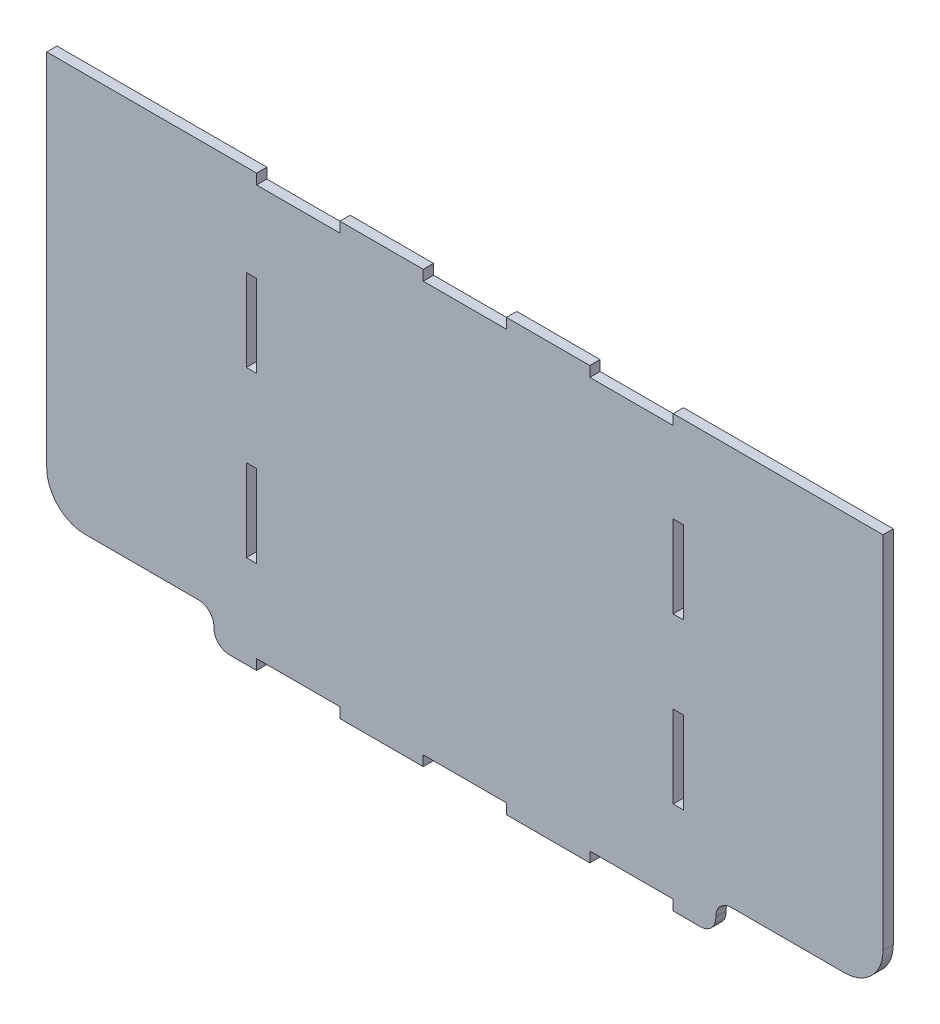
from build123d import *

# Parameters (mm, degrees)
BOSS_EXTRUDE1_DEPTH = 10.16
SKETCH2_W           = 10.166490401
SKETCH2_H           = 81.316938585
SKETCH2_W_2         = 10.166490402
SKETCH2_H_2         = 81.316938584
SKETCH2_W_3         = 82.271298803
SKETCH2_H_3         = 10.16
CUT_EXTRUDE2_DEPTH  = 137.414
CUT_EXTRUDE3_DEPTH  = 1426.179737238
SKETCH5_W           = 82.296
SKETCH5_H           = 10.16
CUT_EXTRUDE4_DEPTH  = 1408.779997291
CUT_EXTRUDE5_DEPTH  = 1408.779997291
CUT_EXTRUDE6_DEPTH  = 25.4


with BuildPart() as part:
    # Sketch1 → Boss-Extrude1 (new body)
    with BuildSketch(Plane.XY):
        with BuildLine():
            Line((0, 0), (1345.447057269, 0))
            Line((1345.447057269, 0), (1156.937235756, -454.288839135))
            add(Edge.make_bspline(
                [(1156.937235756, -454.288839135), (1155.965204773, -456.631331547), (1154.630956054, -458.816896883), (1152.225947859, -461.69350105), (1151.355065983, -462.590813772), (1149.473312624, -464.260936999), (1148.45987476, -465.033112958), (1146.360299176, -466.401155283), (1145.26635201, -467.004685932), (1142.990856866, -468.052074807), (1141.798989191, -468.498505895), (1138.174492983, -469.560599459), (1135.699262078, -469.911644948), (1133.16419506, -469.9)],
                knots=[0, 0, 0, 0, 0.25, 0.25, 0.375, 0.375, 0.5, 0.5, 0.625, 0.625, 0.75, 0.75, 1, 1, 1, 1], degree=3))
            Line((1133.16419506, -469.9), (212.282862208, -469.9))
            add(Edge.make_bspline(
                [(188.509821513, -454.288839135), (189.481852496, -456.631331547), (190.816101215, -458.816896883), (193.22110941, -461.69350105), (194.091991286, -462.590813772), (195.973744645, -464.260936999), (196.987182509, -465.033112958), (199.086758093, -466.401155283), (200.180705259, -467.004685932), (202.456200403, -468.052074807), (203.648068078, -468.498505895), (207.272564286, -469.560599459), (209.747795191, -469.911644948), (212.282862208, -469.9)],
                knots=[0, 0, 0, 0, 0.25, 0.25, 0.375, 0.375, 0.5, 0.5, 0.625, 0.625, 0.75, 0.75, 1, 1, 1, 1], degree=3))
            Line((188.509821513, -454.288839135), (0, 0))
        make_face()
    extrude(amount=BOSS_EXTRUDE1_DEPTH)

    # Sketch2 → Cut-Extrude2 (cut)
    with BuildSketch(Plane.XY.offset(10.16)):
        with Locations((461.924984631, -337.764592123)):
            Rectangle(SKETCH2_W, SKETCH2_H)
        with Locations((883.522072638, -337.764592123)):
            Rectangle(SKETCH2_W_2, SKETCH2_H)
        with Locations((883.522072638, -175.130714953)):
            Rectangle(SKETCH2_W_2, SKETCH2_H_2)
        with Locations((461.924984631, -175.130714953)):
            Rectangle(SKETCH2_W, SKETCH2_H_2)
        with Locations((837.303178036, -464.82)):
            Rectangle(SKETCH2_W_3, SKETCH2_H_3)
        with Locations((672.723528635, -464.82)):
            Rectangle(SKETCH2_W_3, SKETCH2_H_3)
        with Locations((508.143879233, -464.82)):
            Rectangle(SKETCH2_W_3, SKETCH2_H_3)
    extrude(amount=-CUT_EXTRUDE2_DEPTH, mode=Mode.SUBTRACT)

    # Sketch4 → Cut-Extrude3 (cut, through all)
    with BuildSketch(Plane.XY.offset(10.16)):
        Polygon((0, 0), (1345.447057269, 0), (1327.002268746, -44.45), (18.444788523, -44.45), align=None)
    extrude(amount=-CUT_EXTRUDE3_DEPTH, mode=Mode.SUBTRACT)

    # Sketch5 → Cut-Extrude4 (cut, through all)
    with BuildSketch(Plane.XY.offset(10.16)):
        with Locations((672.723528634, -49.53)):
            Rectangle(SKETCH5_W, SKETCH5_H)
        with Locations((837.315528634, -49.53)):
            Rectangle(SKETCH5_W, SKETCH5_H)
        with Locations((508.131528634, -49.53)):
            Rectangle(SKETCH5_W, SKETCH5_H)
    extrude(amount=-CUT_EXTRUDE4_DEPTH, mode=Mode.SUBTRACT)

    # Sketch6 → Cut-Extrude5 (cut, through all)
    with BuildSketch(Plane.XY.offset(10.16)):
        Polygon((192.807539001, -448.077869782), (224.982862208, -469.9), (232.080223429, -549.766419732), (-59.510742861, -242.335130221), (-120.238907144, 37.382474964), (56.544788523, -44.45), (56.544788523, -119.698975594), align=None)
        Polygon((1120.46419506, -469.9), (1113.36683384, -549.766419732), (1404.95780013, -242.335130221), (1465.685964413, 37.382474964), (1288.902268746, -44.45), (1288.902268746, -119.698975594), (1152.639518267, -448.077869782), align=None)
    extrude(amount=-CUT_EXTRUDE5_DEPTH, mode=Mode.SUBTRACT)

    # Sketch7 → Cut-Extrude6 (cut)
    with BuildSketch(Plane.XY.offset(10.16)):
        with BuildLine():
            Line((224.982862208, -469.9), (440.084788523, -469.9))
            ThreePointArc((440.084788523, -469.9), (429.308481178, -465.436307345), (424.844788523, -454.66))
            Line((424.844788523, -454.66), (424.844788523, -453.39))
            ThreePointArc((424.844788523, -453.39), (420.381095868, -442.613692655), (409.604788523, -438.15))
            Line((409.604788523, -438.15), (297.844788523, -438.15))
            ThreePointArc((297.844788523, -438.15), (270.90402016, -426.990768363), (259.744788523, -400.05))
            Line((259.744788523, -400.05), (259.744788523, -44.45))
            Line((259.744788523, -44.45), (56.544788523, -44.45))
            Line((56.544788523, -44.45), (56.544788523, -119.698975594))
            Line((56.544788523, -119.698975594), (192.807539001, -448.077869782))
            Line((192.807539001, -448.077869782), (224.982862208, -469.9))
        make_face()
        with BuildLine():
            ThreePointArc((920.602268746, -454.66), (916.138576091, -465.436307345), (905.362268746, -469.9))
            Line((905.362268746, -469.9), (1120.46419506, -469.9))
            Line((1120.46419506, -469.9), (1152.639518267, -448.077869782))
            Line((1152.639518267, -448.077869782), (1288.902268746, -119.698975594))
            Line((1288.902268746, -119.698975594), (1288.902268746, -44.45))
            Line((1288.902268746, -44.45), (1085.702268746, -44.45))
            Line((1085.702268746, -44.45), (1085.702268746, -400.05))
            ThreePointArc((1085.702268746, -400.05), (1074.543037109, -426.990768363), (1047.602268746, -438.15))
            Line((1047.602268746, -438.15), (935.842268746, -438.15))
            ThreePointArc((935.842268746, -438.15), (925.065961401, -442.613692655), (920.602268746, -453.39))
            Line((920.602268746, -453.39), (920.602268746, -454.66))
        make_face()
    extrude(amount=-CUT_EXTRUDE6_DEPTH, mode=Mode.SUBTRACT)


solid = part.part
